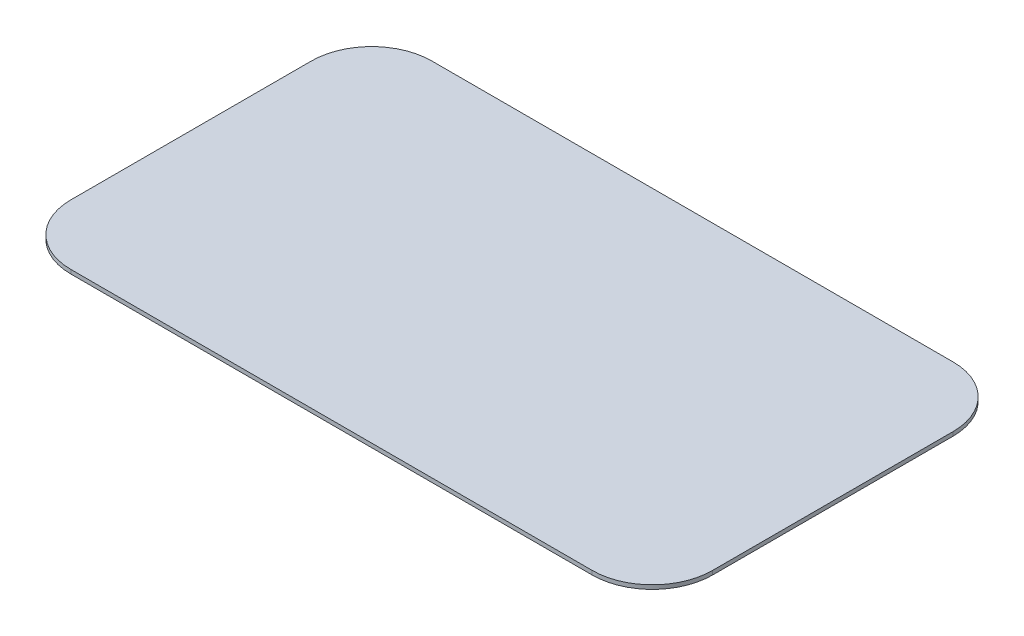
from build123d import *

# Parameters (mm, degrees)
BOSS_EXTRUDE1_DEPTH = 0.1


with BuildPart() as part:
    # Sketch1 → Boss-Extrude1 (new body)
    with BuildSketch(Plane(origin=(0, 0, 0), x_dir=(1, 0, 0), z_dir=(0, 1, 0))):
        with BuildLine():
            Line((-6.5, -4.5), (6.5, -4.5))
            ThreePointArc((6.5, -4.5), (7.560660172, -4.060660172), (8, -3))
            Line((8, -3), (8, 3))
            ThreePointArc((8, 3), (7.560660172, 4.060660172), (6.5, 4.5))
            Line((6.5, 4.5), (-6.5, 4.5))
            ThreePointArc((-6.5, 4.5), (-7.560660172, 4.060660172), (-8, 3))
            Line((-8, 3), (-8, -3))
            ThreePointArc((-8, -3), (-7.560660172, -4.060660172), (-6.5, -4.5))
        make_face()
    extrude(amount=BOSS_EXTRUDE1_DEPTH)


solid = part.part
